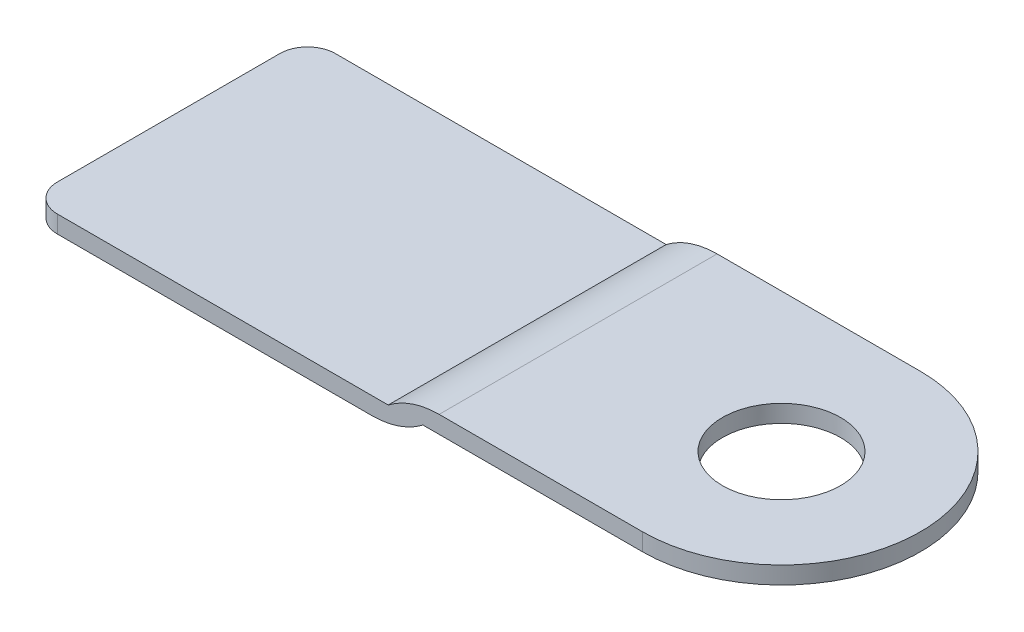
from build123d import *

# Parameters (mm, degrees)
BOSS_EXTRUDE1_DEPTH = 10
FILLET1_R           = 2
FILLET2_RADIUS      = 10
FILLET2_LENGTH      = 1.25
FILLET3_R           = 6
SKETCH2_R           = 4.25
CUT_EXTRUDE1_DEPTH  = 29.94740921


with BuildPart() as part:
    # Sketch1 → Boss-Extrude1 (new, symmetric)
    with BuildSketch(Plane.XY):
        Polygon((0, 1.25), (-1.25, 0), (-27.05, 0), (-27.05, -1.25), (0, -1.25), (1.25, 0), (27.05, 0), (27.05, 1.25), align=None)
    extrude(amount=BOSS_EXTRUDE1_DEPTH, both=True)

    # Fillet1
    fillet1_edges = [part.edges().sort_by_distance(p)[0] for p in [
        (-27.05, -0.625, -10),
        (-27.05, -0.625, 10),
    ]]
    fillet(fillet1_edges, radius=FILLET1_R)

    # Fillet2: full round fillet: the end face becomes a half cylinder, R = half its width
    fillet2_face = Plane((27.05, 0.625, 0), x_dir=(0, -1, 0), z_dir=(1, 0, 0))  # on the end face: x along it, z out of the body
    fillet2_slab = fillet2_face.offset(-FILLET2_RADIUS / 2) * Box(FILLET2_LENGTH, 2 * FILLET2_RADIUS, FILLET2_RADIUS, mode=Mode.PRIVATE)  # the body's end, R deep
    fillet2_round = Plane((17.05, 0.625, 0), x_dir=(1, 0, 0), z_dir=(0, -1, 0)) * Cylinder(FILLET2_RADIUS, FILLET2_LENGTH, mode=Mode.PRIVATE)  # its axis R under the face
    add(fillet2_slab - fillet2_round, mode=Mode.SUBTRACT)

    # Fillet3
    # the kernel refuses this fillet: 6 mm, written as the material it takes off along each edge
    with BuildSketch(Plane(origin=(0, -1.25, -16.039298937), x_dir=(-1, 0, 0), z_dir=(0, 0, 1))) as fillet3_piece_1:
        with BuildLine():
            CenterArc((2.415719575, -6), FILLET3_R, 90, 37.658462006)
            Line((-1.25, -1.25), (-1.323314391, -1.155))
            ThreePointArc((-1.323314391, -1.155), (-0.709852814, -0.540147186), (-0.084852814, 0.084852814))
            Line((-0.084852814, 0.084852814), (0, 0.12))
            Line((0, 0.12), (2.415719575, 0.12))
            Line((2.415719575, 0.12), (2.415719575, 0))
        make_face()
    extrude(amount=32.078597873, mode=Mode.SUBTRACT)
    with BuildSketch(Plane(origin=(0, 1.25, 16.039298937), x_dir=(1, 0, 0), z_dir=(0, 0, -1))) as fillet3_piece_2:
        with BuildLine():
            CenterArc((2.415719575, 6), FILLET3_R, 232.341537994, 37.658462006)
            Line((-1.25, 1.25), (-1.323314391, 1.155))
            ThreePointArc((-1.323314391, 1.155), (-0.709852814, 0.540147186), (-0.084852814, -0.084852814))
            Line((-0.084852814, -0.084852814), (0, -0.12))
            Line((0, -0.12), (2.415719575, -0.12))
            Line((2.415719575, -0.12), (2.415719575, 0))
        make_face()
    extrude(amount=32.078597873, mode=Mode.SUBTRACT)

    # Sketch2 → Cut-Extrude1 (cut, through all)
    with BuildSketch(Plane(origin=(0, 1.25, 0), x_dir=(1, 0, 0), z_dir=(0, 1, 0))):
        with Locations(Location((17.05, 0, 0), (0, 0, 270))):
            Circle(SKETCH2_R)
    extrude(amount=-CUT_EXTRUDE1_DEPTH, mode=Mode.SUBTRACT)


solid = part.part
